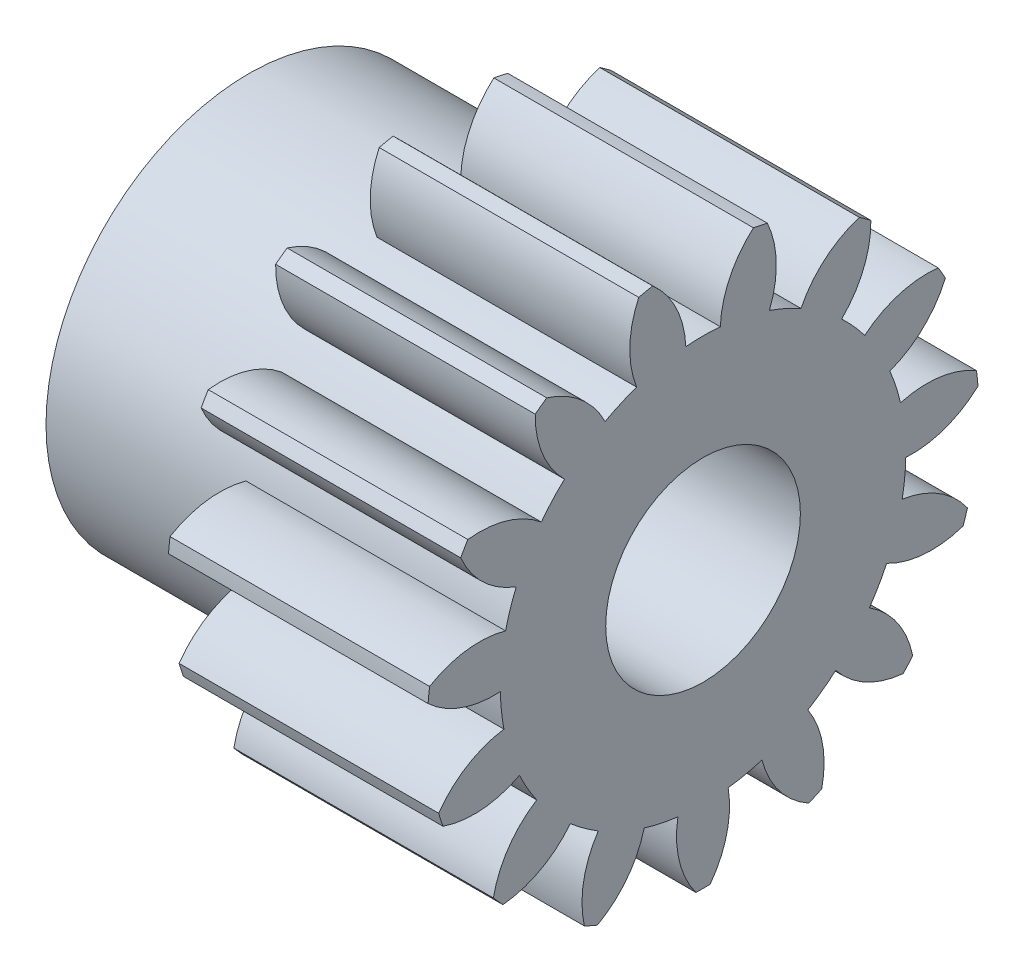
from build123d import *
from build123d.topology import SkipClean

# Parameters (mm, degrees)
BASPROSKE_W      = 8
BASPROSKE_H      = 8.5
TOOTHCUT_DEPTH   = 15.439529078
TEETHCUTS_COUNT  = 15
TEETHCUTS_ANGLE  = 336
HUBNEARONE_START = 3.0001524
HUBNEAONESKE_R   = 6.249
HUBNEARONE_DEPTH = 3.0001524
BORSKE_R         = 3
BORE_DEPTH       = 11.0001524
MOVE_FACE1_BY    = 3


with BuildPart() as part:
    # BasProSke → Base-Revolve (revolve)
    with BuildSketch(Plane(origin=(0, 0, 0), x_dir=(1, 0, 0), z_dir=(0, 1, 0))):
        with Locations((4, 4.25)):
            Rectangle(BASPROSKE_W, BASPROSKE_H)
    revolve(axis=Axis((-10, 0, 0), (1, 0, 0)))

    # TooCutSke → ToothCut (cut, through all)
    with BuildSketch(Plane(origin=(0, 0, 0), x_dir=(0, 0, -1), z_dir=(1, 0, 0))):
        with BuildLine():
            ThreePointArc((0.531576138, 6.226349477), (0, 6.249), (-0.531576138, 6.226349477))
            ThreePointArc((-0.531576138, 6.226349477), (-0.830301624, 7.411024729), (-1.576608494, 8.378350125))
            ThreePointArc((-1.576608494, 8.378350125), (0, 8.5254), (1.576608494, 8.378350125))
            ThreePointArc((1.576608494, 8.378350125), (0.830301624, 7.411024729), (0.531576138, 6.226349477))
        make_face()
    toothcut = extrude(amount=TOOTHCUT_DEPTH, mode=Mode.SUBTRACT)

    # TeethCuts: ToothCut ×15 about axis
    teethcuts_axis = Axis((-10, 0, 0), (1, 0, 0))
    for i in range(1, TEETHCUTS_COUNT):
        add(toothcut.rotate(teethcuts_axis, i * TEETHCUTS_ANGLE / (TEETHCUTS_COUNT - 1)), mode=Mode.SUBTRACT)

    # HubNeaOneSke → HubNearOne (add)
    with SkipClean():  # the faces are left unmerged after this step: merging them gives an invalid solid
        with BuildSketch(Plane.ZY.offset(HUBNEARONE_START)):
            Circle(HUBNEAONESKE_R)
        extrude(amount=-HUBNEARONE_DEPTH)

    # BorSke → Bore (cut, symmetric)
    with SkipClean():  # the faces are left unmerged after this step: merging them gives an invalid solid
        with BuildSketch(Plane(origin=(0, 0, 0), x_dir=(0, 0, -1), z_dir=(1, 0, 0))):
            Circle(BORSKE_R)
        extrude(amount=BORE_DEPTH, both=True, mode=Mode.SUBTRACT)

    # Move Face1: a face moved outward by 3.0
    extrude(part.faces().sort_by_distance((-3.0001524, -3.1245, 0))[0], amount=MOVE_FACE1_BY, dir=(-1, 0, 0))


solid = part.part
